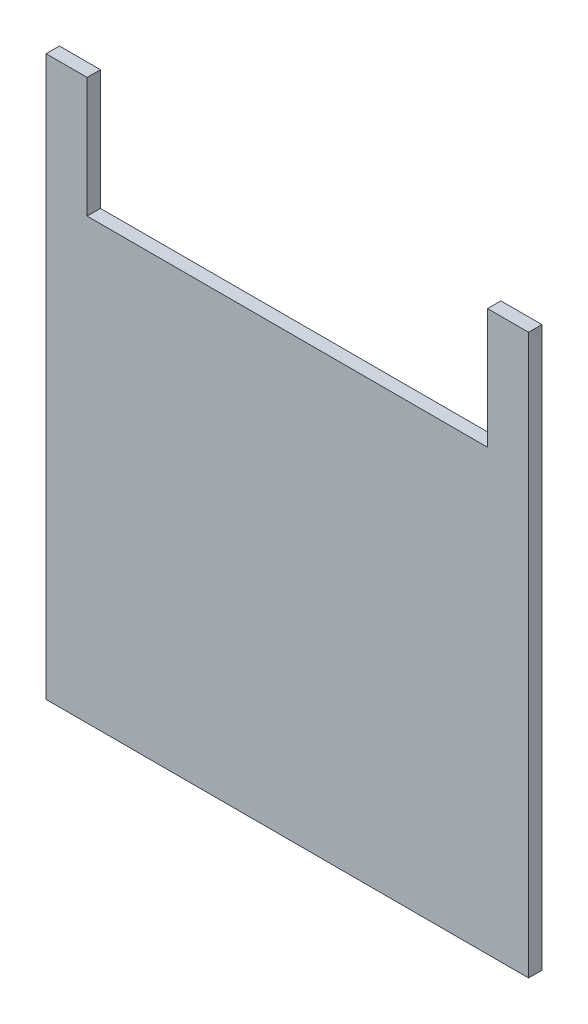
from build123d import *

# Parameters (mm, degrees)
SKETCH1_W           = 723
SKETCH1_H           = 838
BOSS_EXTRUDE1_DEPTH = 20
CUT_EXTRUDE1_REACH  = 555.754
SKETCH2_W           = 600
SKETCH2_H           = 180


with BuildPart() as part:
    # Sketch1 → Boss-Extrude1 (new body)
    with BuildSketch(Plane.XY):
        Rectangle(SKETCH1_W, SKETCH1_H)
    extrude(amount=BOSS_EXTRUDE1_DEPTH)

    # Sketch2 → Cut-Extrude1 (cut, up to next)
    with BuildSketch(Plane.XY.offset(20), mode=Mode.PRIVATE) as cut_extrude1_sk1:
        with Locations((0, 329)):
            Rectangle(SKETCH2_W, SKETCH2_H)
    cut_extrude1_tool1 = extrude(cut_extrude1_sk1.sketch, amount=-CUT_EXTRUDE1_REACH, mode=Mode.PRIVATE) & part.part
    add(cut_extrude1_tool1.solids().sort_by_distance((0, 329, 20))[0], mode=Mode.SUBTRACT)


solid = part.part
